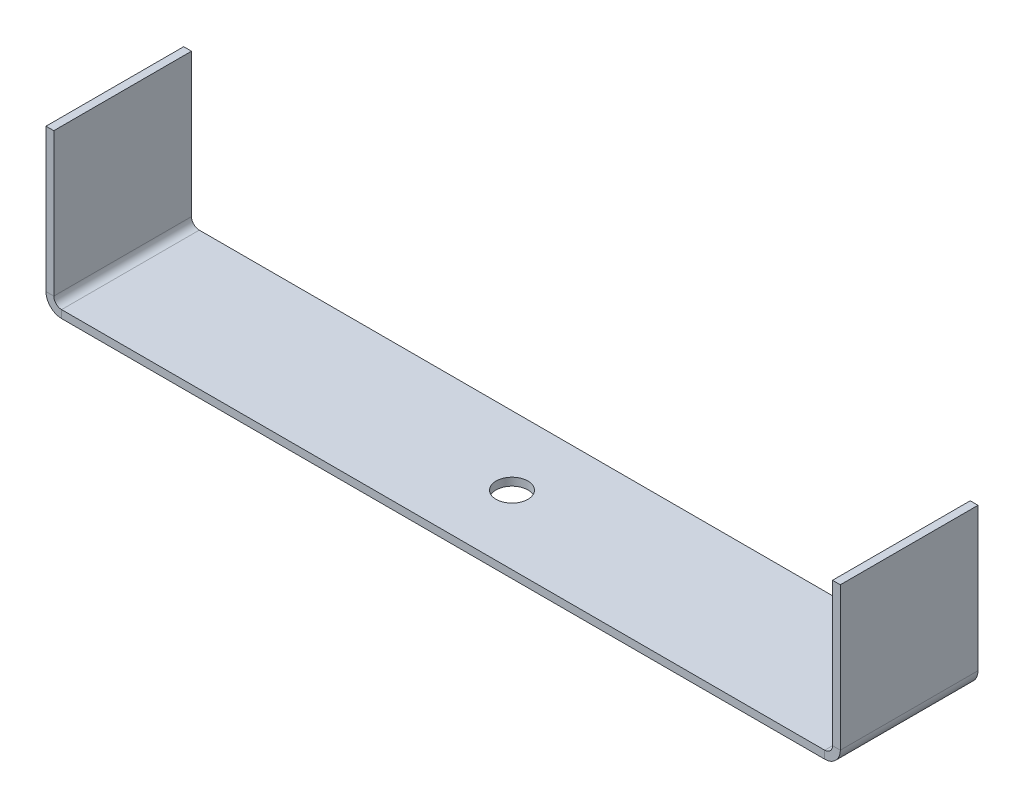
from build123d import *

# Parameters (mm, degrees)
SM_BASE_FLANGE_1_DEPTH = 6.5
OTHER_1_OUTLINE_R      = 1.5
OTHER_1_DEPTH          = 0.7366


# Read off the part's stored shape, not the designer's step: Отверстие1
# Sheet-metal steps are written as plain solids
with BuildPart() as part:
    # Sketch 1 → Базовая кромка1 (new, symmetric)
    with BuildSketch(Plane.XY):
        with BuildLine():
            Line((-37.5, 15), (-37.5, 1.4732))
            ThreePointArc((-37.5, 1.4732), (-37.06850971, 0.43149029), (-36.0268, 0))
            Line((-36.0268, 0), (36.0268, 0))
            ThreePointArc((36.0268, 0), (37.06850971, 0.43149029), (37.5, 1.4732))
            Line((37.5, 1.4732), (37.5, 15))
            Line((37.5, 15), (36.7634, 15))
            Line((36.7634, 15), (36.7634, 1.4732))
            ThreePointArc((36.7634, 1.4732), (36.547654855, 0.952345145), (36.0268, 0.7366))
            Line((36.0268, 0.7366), (-36.0268, 0.7366))
            ThreePointArc((-36.0268, 0.7366), (-36.547654855, 0.952345145), (-36.7634, 1.4732))
            Line((-36.7634, 1.4732), (-36.7634, 15))
            Line((-36.7634, 15), (-37.5, 15))
        make_face()
    extrude(amount=SM_BASE_FLANGE_1_DEPTH, both=True)

    # Отверстие1 outline → Отверстие1 (cut)
    with BuildSketch(Plane(origin=(0, 0, 0), x_dir=(1, 0, 0), z_dir=(0, 1, 0))):
        Circle(OTHER_1_OUTLINE_R)
    extrude(amount=OTHER_1_DEPTH, mode=Mode.SUBTRACT)


solid = part.part
